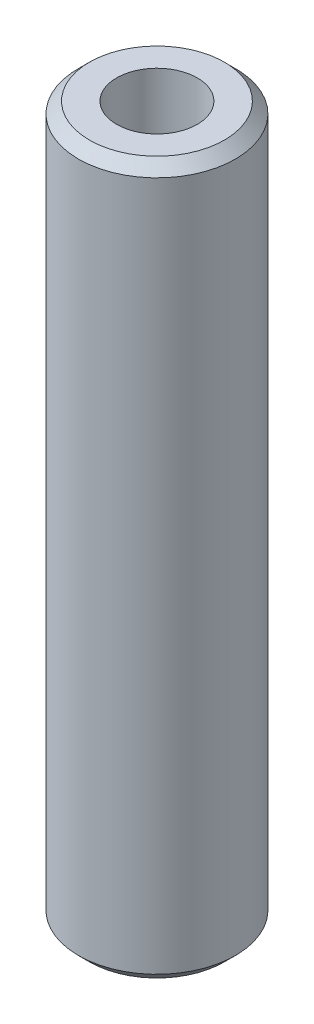
from build123d import *

# Parameters (mm, degrees)
SKETCH1_R           = 15
BOSS_EXTRUDE1_DEPTH = 136.017494169
SKETCH2_R           = 7.705174479
CUT_EXTRUDE1_DEPTH  = 138.661754747
CHAMFER1_SIZE       = 2.098391504


with BuildPart() as part:
    # Sketch1 → Boss-Extrude1 (new body)
    with BuildSketch(Plane(origin=(0, 0, 0), x_dir=(1, 0, 0), z_dir=(0, 1, 0))):
        Circle(SKETCH1_R)
    extrude(amount=BOSS_EXTRUDE1_DEPTH)

    # Sketch2 → Cut-Extrude1 (cut, through all)
    with BuildSketch(Plane(origin=(0, 0, 0), x_dir=(1, 0, 0), z_dir=(0, 1, 0))):
        Circle(SKETCH2_R)
    extrude(amount=CUT_EXTRUDE1_DEPTH, mode=Mode.SUBTRACT)

    # Chamfer1
    chamfer1_edges = [part.edges().sort_by_distance(p)[0] for p in [
        (-15, 136.017494169, 0),
        (-15, 0, 0),
    ]]
    chamfer(chamfer1_edges, length=CHAMFER1_SIZE)


solid = part.part
